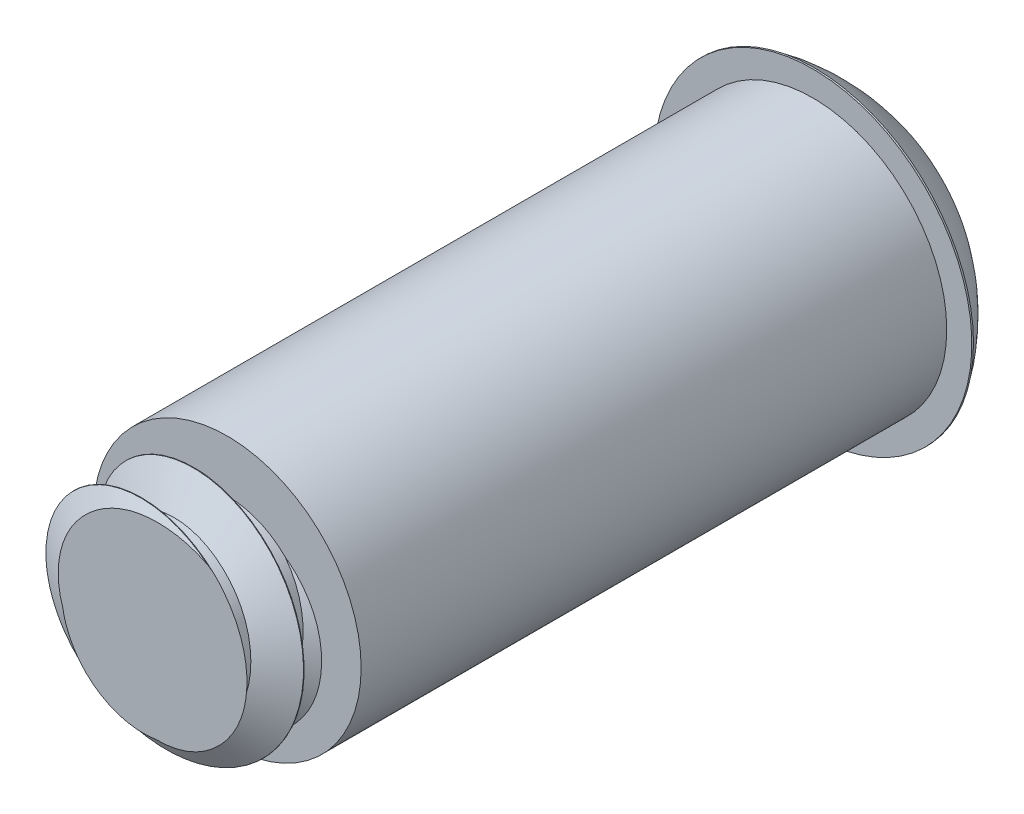
from build123d import *

# Parameters (mm, degrees)
SKETCH2_R           = 1.7526
BOSS_EXTRUDE1_DEPTH = 1.27
CUT_SWEEP1_PITCH    = 0.79375
SKETCH4_R           = 2.032
BOSS_EXTRUDE2_DEPTH = 8.89
SKETCH5_R           = 2.413
BOSS_EXTRUDE3_DEPTH = 0.0254
DOME1_FACE_RADIUS   = 2.413
DOME1_HEIGHT        = 1.27


with BuildPart() as part:
    # Sketch2 → Boss-Extrude1 (new body)
    with BuildSketch(Plane.XY):
        Circle(SKETCH2_R)
    extrude(amount=BOSS_EXTRUDE1_DEPTH)

    # Cut-Sweep1: arcs per turn and ends read off the stored shape
    # Cut-Sweep1: the profile of Sketch3 profile screwed along a left-hand helix through 7.400003 turns, 8 arcs to a turn; built about Z, then put on its axis
    cut_sweep1_z = Axis((0, 0, 0), (0, 0, 1))
    cut_sweep1_corners = [(1.7529, 0, -0.401064108), (1.2446, 0, -0.69453125), (1.2446, 0, -0.89296875), (1.7529, 0, -1.186435892)]
    with BuildLine(mode=Mode.PRIVATE) as cut_sweep1_profile:
        Line(cut_sweep1_corners[0], cut_sweep1_corners[1])
        Line(cut_sweep1_corners[1], cut_sweep1_corners[2])
        Line(cut_sweep1_corners[2], cut_sweep1_corners[3])
        Line(cut_sweep1_corners[3], cut_sweep1_corners[0])
    cut_sweep1_cap = Face(cut_sweep1_profile.wire())
    cut_sweep1_turn_angles = [0, -22.5, -45, -67.5, -90, -112.5, -135, -157.5, -180, -202.5, -225, -247.5, -270, -292.5, -315, -337.5, -360]
    cut_sweep1_turn_weights = [1, 0.9238795325112867, 1, 0.9238795325112867, 1, 0.9238795325112867, 1, 0.9238795325112867, 1, 0.9238795325112867, 1, 0.9238795325112867, 1, 0.9238795325112867, 1, 0.9238795325112867, 1]
    cut_sweep1_turn_rails = [Edge.make_bspline([Vector(p[0], p[1], 0).rotate(cut_sweep1_z, cut_sweep1_turn_angles[k]) / cut_sweep1_turn_weights[k] + Vector(0, 0, p[2] + -CUT_SWEEP1_PITCH * cut_sweep1_turn_angles[k] / 360) for k in range(17)], [0, 0, 0, 1, 1, 2, 2, 3, 3, 4, 4, 5, 5, 6, 6, 7, 7, 8, 8, 8], 2, cut_sweep1_turn_weights) for p in cut_sweep1_corners]
    cut_sweep1_turn_sides = [Face.make_surface_from_curves(cut_sweep1_turn_rails[p[0]], cut_sweep1_turn_rails[p[1]]) for p in [(0, 1), (1, 2), (2, 3), (3, 0)]]
    cut_sweep1_last_angles = [-2520, -2542.5, -2565, -2587.5, -2610, -2632.5, -2655, -2659.5005, -2664.001]
    cut_sweep1_last_weights = [1, 0.9238795325112867, 1, 0.9238795325112867, 1, 0.9238795325112867, 1, 0.9969166490103938, 1]
    cut_sweep1_last_rails = [Edge.make_bspline([Vector(p[0], p[1], 0).rotate(cut_sweep1_z, cut_sweep1_last_angles[k]) / cut_sweep1_last_weights[k] + Vector(0, 0, p[2] + -CUT_SWEEP1_PITCH * cut_sweep1_last_angles[k] / 360) for k in range(9)], [0, 0, 0, 1, 1, 2, 2, 3, 3, 4, 4, 4], 2, cut_sweep1_last_weights) for p in cut_sweep1_corners]
    cut_sweep1_last_sides = [Face.make_surface_from_curves(cut_sweep1_last_rails[p[0]], cut_sweep1_last_rails[p[1]]) for p in [(0, 1), (1, 2), (2, 3), (3, 0)]]
    cut_sweep1 = Plane(origin=(0, 0, 0), x_dir=(0, 1, 0), z_dir=(0, 0, 1)) * Solid(Shell([*[p.moved(Location((0, 0, CUT_SWEEP1_PITCH * i))) for i in range(7) for p in cut_sweep1_turn_sides], *cut_sweep1_last_sides, cut_sweep1_cap, cut_sweep1_cap.rotate(cut_sweep1_z, -2664.001).moved(Location((0, 0, -CUT_SWEEP1_PITCH * -2664.001 / 360)))]))
    add(cut_sweep1, mode=Mode.SUBTRACT)

    # Sketch4 → Boss-Extrude2 (add)
    with BuildSketch(Plane.XY):
        Circle(SKETCH4_R)
    extrude(amount=-BOSS_EXTRUDE2_DEPTH)

    # Sketch5 → Boss-Extrude3 (add)
    with BuildSketch(Plane(origin=(0, 0, -8.89), x_dir=(-1, 0, 0), z_dir=(0, 0, -1))):
        Circle(SKETCH5_R)
    extrude(amount=BOSS_EXTRUDE3_DEPTH)

    # Dome1: a dome of height H over a round flat face of radius A is a cap of a sphere of radius (A * A + H * H) / (2 * H)
    dome1_r = (DOME1_FACE_RADIUS * DOME1_FACE_RADIUS + DOME1_HEIGHT * DOME1_HEIGHT) / (2 * DOME1_HEIGHT)
    dome1_base = Plane((0, 0, -8.9154), z_dir=(0, 0, -1))
    with Locations(dome1_base.offset(DOME1_HEIGHT - dome1_r)):
        dome1_ball = Sphere(dome1_r, mode=Mode.PRIVATE)
    add(split(dome1_ball, bisect_by=dome1_base, keep=Keep.TOP, mode=Mode.PRIVATE))


solid = part.part
